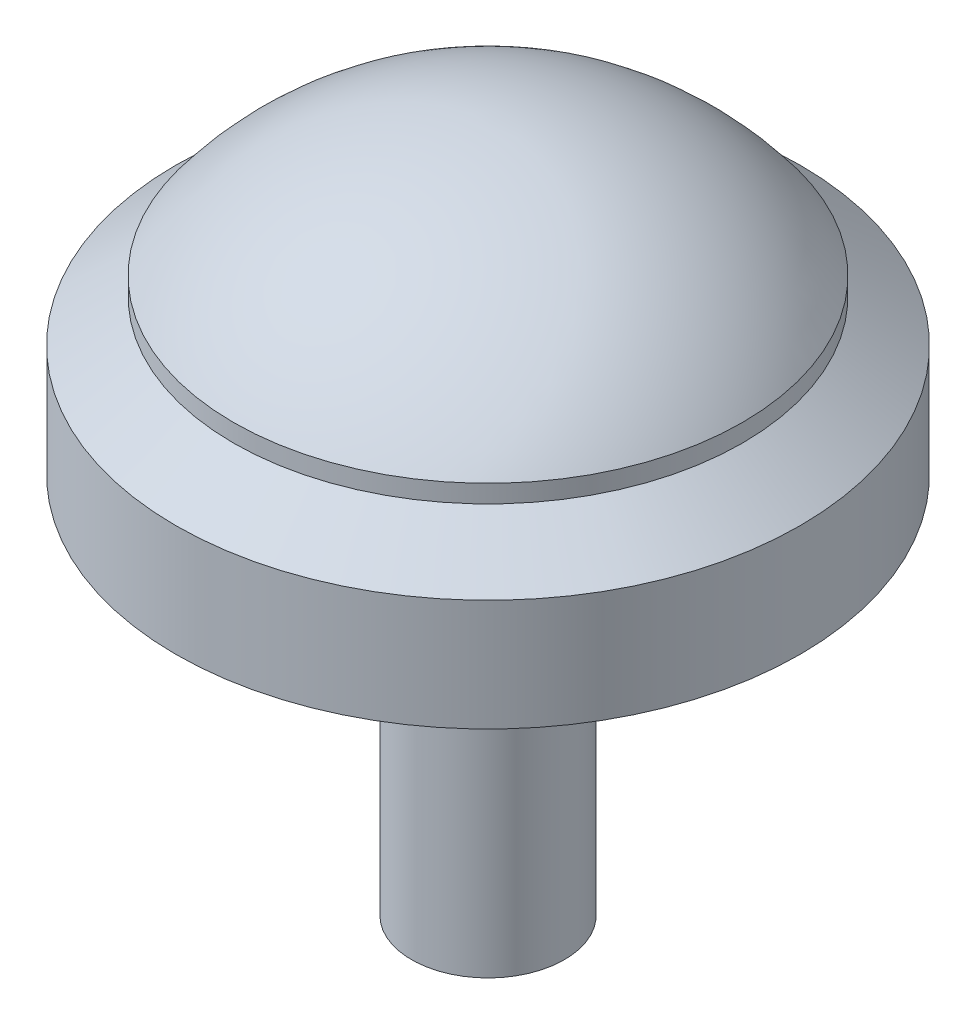
from build123d import *
from build123d.topology import SkipClean

# Parameters (mm, degrees)
SKETCH1_R           = 49
BOSS_EXTRUDE1_DEPTH = 25.5
SKETCH2_R           = 39.95
BOSS_EXTRUDE2_DEPTH = 1.5
DOME1_FACE_RADIUS   = 39.95
DOME1_HEIGHT        = 20
CHAMFER1_SIZE       = 8
CHAMFER1_SIZE_2     = 10.811379504
SKETCH3_R           = 12
BOSS_EXTRUDE3_DEPTH = 60


with BuildPart() as part:
    # Sketch1 → Boss-Extrude1 (new body)
    with BuildSketch(Plane(origin=(0, 0, 0), x_dir=(1, 0, 0), z_dir=(0, 1, 0))):
        with Locations(Location((0, 0, 0), (0, 0, 270))):
            Circle(SKETCH1_R)
    extrude(amount=BOSS_EXTRUDE1_DEPTH)

    # Sketch2 → Boss-Extrude2 (add)
    with BuildSketch(Plane(origin=(0, 25.5, 0), x_dir=(1, 0, 0), z_dir=(0, 1, 0))):
        with Locations(Location((0, 0, 0), (0, 0, 270))):
            Circle(SKETCH2_R)
    extrude(amount=BOSS_EXTRUDE2_DEPTH)

    # Dome1: a dome of height H over a round flat face of radius A is a cap of a sphere of radius (A * A + H * H) / (2 * H)
    dome1_r = (DOME1_FACE_RADIUS * DOME1_FACE_RADIUS + DOME1_HEIGHT * DOME1_HEIGHT) / (2 * DOME1_HEIGHT)
    dome1_base = Plane((0, 27, 0), z_dir=(0, 1, 0))
    with Locations(dome1_base.offset(DOME1_HEIGHT - dome1_r)):
        dome1_ball = Sphere(dome1_r, mode=Mode.PRIVATE)
    add(split(dome1_ball, bisect_by=dome1_base, keep=Keep.TOP, mode=Mode.PRIVATE))

    # Chamfer1
    # the kernel refuses this chamfer: 10.811379504, 8 mm, written as the material it takes off along each edge
    with BuildSketch(Plane(origin=(0, 25.5, 0), x_dir=(0, 0, 1), z_dir=(-1, 0, 0))) as chamfer1_piece_1_section:
        Polygon((49, -CHAMFER1_SIZE), (49 - CHAMFER1_SIZE_2, 0), (49, 0), align=None)
    chamfer1_piece_1 = revolve(axis=Axis((0, 25.5, 0), (0, 1, 0)), mode=Mode.PRIVATE)
    chamfer1_piece_1 = chamfer1_piece_1 - Plane(origin=(0, 20.910194106, 0), x_dir=(0, 0, 1), z_dir=(0, -1, 0)) * Cylinder(39.95, 196, mode=Mode.PRIVATE)
    add(chamfer1_piece_1, mode=Mode.SUBTRACT)

    # Sketch3 → Boss-Extrude3 (add)
    with SkipClean():  # the faces are left unmerged after this step: merging them gives an invalid solid
        with BuildSketch(Plane.XZ):
            with Locations(Location((0, 0, 0), (0, 0, 270))):
                Circle(SKETCH3_R)
        extrude(amount=BOSS_EXTRUDE3_DEPTH)


solid = part.part
